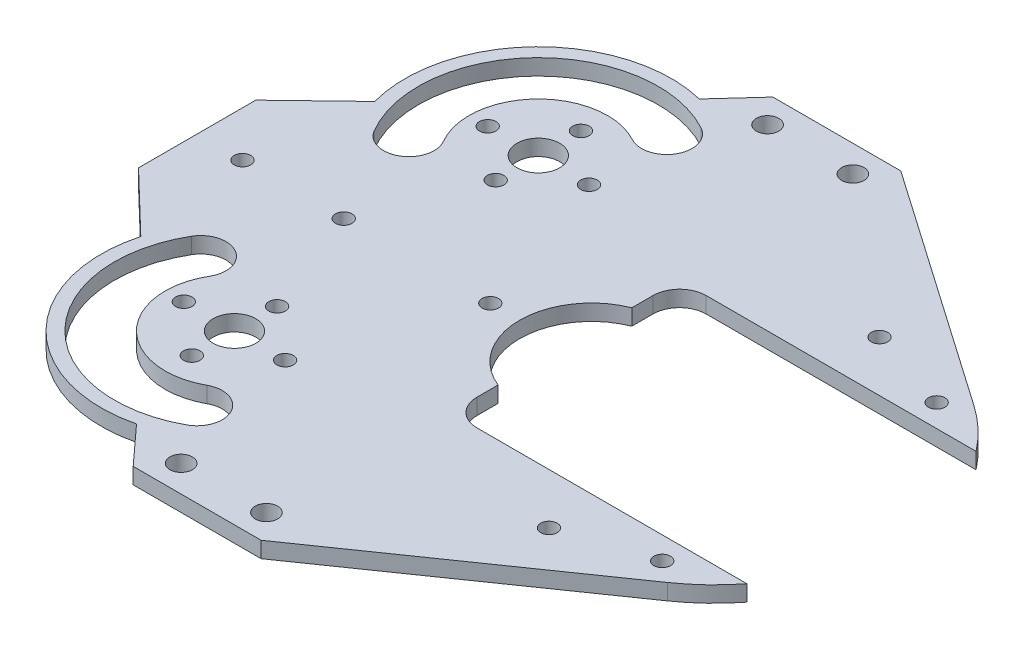
from build123d import *
from build123d.topology import SkipClean

# Parameters (mm, degrees)
SKETCH_1_R          = 1.55
SKETCH_1_R_2        = 4
EXTRUDE_1_DEPTH     = 3
EXTRUDE_START       = -3
SKETCH_2_R          = 2.1
EXTRUDE_3_DEPTH     = 3
FILLET_1_R          = 4
FILLET_2_R          = 314
FILLET_3_R          = 314
FILLET_4_R          = 4
CUT_EXTRUDE_2_DEPTH = 3
EXTRUDE_4_DEPTH     = 3
EXTRUDE_5_DEPTH     = 3
SKETCH_6_R          = 1.55
CUT_EXTRUDE_3_DEPTH = 10


with BuildPart() as part:
    # 草图1 → 凸台-拉伸1 (new body)
    with BuildSketch(Plane(origin=(0, 0, 0), x_dir=(1, 0, 0), z_dir=(0, 1, 0))):
        with BuildLine():
            Line((-27.819418646, 37.14796354), (-55, 11))
            Line((-55, 11), (-55, -11))
            Line((-55, -11), (-27.819418646, -37.14796354))
            ThreePointArc((-27.819418646, -37.14796354), (-23.984664844, -39.630488814), (-19.5, -40.5))
            Line((-19.5, -40.5), (-17.421399483, -40.31860482))
            Line((-17.421399483, -40.31860482), (45.042813224, -34.867481809))
            ThreePointArc((45.042813224, -34.867481809), (58.724014778, -30.74585061), (69.617928959, -21.5))
            Line((69.617928959, -21.5), (19, -21.5))
            ThreePointArc((19, -21.5), (15.464466094, -20.035533906), (14, -16.5))
            Line((14, -16.5), (14, -12.539936204))
            ThreePointArc((14, -12.539936204), (5.5, 0), (14, 12.539936204))
            Line((14, 12.539936204), (14, 16.5))
            ThreePointArc((14, 16.5), (15.464466094, 20.035533906), (19, 21.5))
            Line((19, 21.5), (69.617928959, 21.5))
            ThreePointArc((69.617928959, 21.5), (58.724014778, 30.74585061), (45.042813224, 34.867481809))
            Line((45.042813224, 34.867481809), (-17.421399483, 40.31860482))
            Line((-17.421399483, 40.31860482), (-19.5, 40.5))
            ThreePointArc((-19.5, 40.5), (-23.984664844, 39.630488814), (-27.819418646, 37.14796354))
        make_face()
        with Locations(Location((-29, -28.5, 0), (0, 0, 270))):
            Circle(SKETCH_1_R, mode=Mode.SUBTRACT)
        with Locations(Location((-19.5, -36.5, 0), (0, 0, 270))):
            Circle(SKETCH_1_R, mode=Mode.SUBTRACT)
        with Locations(Location((-19.5, -28.5, 0), (0, 0, 270))):
            Circle(SKETCH_1_R_2, mode=Mode.SUBTRACT)
        with Locations(Location((-10, -28.5, 0), (0, 0, 270))):
            Circle(SKETCH_1_R, mode=Mode.SUBTRACT)
        with Locations(Location((-19.5, -20.5, 0), (0, 0, 270))):
            Circle(SKETCH_1_R, mode=Mode.SUBTRACT)
        with Locations(Location((-46.5, 0, 0), (0, 0, 270))):
            Circle(SKETCH_1_R, mode=Mode.SUBTRACT)
        with Locations(Location((-27.5, 0, 0), (0, 0, 270))):
            Circle(SKETCH_1_R, mode=Mode.SUBTRACT)
        with Locations(Location((0, 0, 0), (0, 0, 270))):
            Circle(SKETCH_1_R, mode=Mode.SUBTRACT)
        with Locations(Location((-29, 28.5, 0), (0, 0, 270))):
            Circle(SKETCH_1_R, mode=Mode.SUBTRACT)
        with Locations(Location((-19.5, 20.5, 0), (0, 0, 270))):
            Circle(SKETCH_1_R, mode=Mode.SUBTRACT)
        with Locations(Location((-19.5, 28.5, 0), (0, 0, 270))):
            Circle(SKETCH_1_R_2, mode=Mode.SUBTRACT)
        with Locations(Location((-10, 28.5, 0), (0, 0, 270))):
            Circle(SKETCH_1_R, mode=Mode.SUBTRACT)
        with Locations(Location((-19.5, 36.5, 0), (0, 0, 270))):
            Circle(SKETCH_1_R, mode=Mode.SUBTRACT)
    extrude(amount=EXTRUDE_1_DEPTH)

    # 草图2 → 凸台-拉伸3 (add)
    with BuildSketch(Plane(origin=(0, 3, 0), x_dir=(1, 0, 0), z_dir=(0, 1, 0)).offset(EXTRUDE_START)):
        with BuildLine():
            Line((-7, 60), (-28.363974347, 36.588878709))
            ThreePointArc((-28.363974347, 36.588878709), (-26.665503977, 38.125775437), (-24.705947863, 39.311942788))
            Line((-24.705947863, 39.311942788), (-19.656872495, 39.177623495))
            Line((-19.656872495, 39.177623495), (-17.421399483, 40.31860482))
            Line((-17.421399483, 40.31860482), (17, 37.314720281))
            Line((17, 37.314720281), (17, 50))
            Line((17, 50), (17, 60))
            Line((17, 60), (-7, 60))
        make_face()
        with Locations(Location((13, 55, 0), (0, 0, 270))):
            Circle(SKETCH_2_R, mode=Mode.SUBTRACT)
        with Locations(Location((-3, 55, 0), (0, 0, 270))):
            Circle(SKETCH_2_R, mode=Mode.SUBTRACT)
    extrude_3 = extrude(amount=EXTRUDE_3_DEPTH)

    # 圆角1
    fillet_1_edges = [part.edges().sort_by_distance(p)[0] for p in [
        (17, 1.5, -37.314720281),
    ]]
    fillet(fillet_1_edges, radius=FILLET_1_R)

    # 圆角2
    # the kernel refuses this fillet: 314 mm, written as the material it adds along each edge
    with BuildSketch(Plane(origin=(-28.100791786, 0, -36.877280051), x_dir=(0.6740732257670936, 0, -0.7386645289330906), z_dir=(0, 1, 0))) as fillet_2_piece_1:
        with BuildLine():
            CenterArc((FILLET_2_R * 0.032536346624, FILLET_2_R), FILLET_2_R, 266.272924122, 3.727075878)
            Line((-FILLET_2_R * 0.0324675326171, FILLET_2_R * 0.0021149887469), (0, 0))
            Line((0, 0), (FILLET_2_R * 0.032536346624, 0))
        make_face()
    extrude(amount=3)

    # 镜向2: 凸台-拉伸3 across plane
    add(extrude_3.mirror(Plane.XY))

    # 圆角3
    # the kernel refuses this fillet: 314 mm, written as the material it adds along each edge
    with BuildSketch(Plane(origin=(-28.100791786, 0, 36.877280051), x_dir=(-0.7206636283184775, 0, -0.6932848871992288), z_dir=(0, 1, 0))) as fillet_3_piece_1:
        with BuildLine():
            CenterArc((FILLET_3_R * 0.0325363466241, FILLET_3_R), FILLET_3_R, 266.272924122, 3.727075878)
            Line((-FILLET_3_R * 0.0324675326171, FILLET_3_R * 0.0021149887469), (0, 0))
            Line((0, 0), (FILLET_3_R * 0.032536346624, 0))
        make_face()
    extrude(amount=3)

    # 圆角4
    fillet_4_edges = [part.edges().sort_by_distance(p)[0] for p in [
        (17, 1.5, 37.314720281),
    ]]
    fillet(fillet_4_edges, radius=FILLET_4_R)

    # 草图3 → 切除-拉伸2 (cut)
    with BuildSketch(Plane.XZ):
        with BuildLine():
            ThreePointArc((-8.686732059, 48.231275591), (-35.637539634, 44.178960889), (-38.911435654, 17.122558906))
            ThreePointArc((-38.911435654, 17.122558906), (-32.411561674, 15.426493388), (-30.715496156, 21.926367368))
            ThreePointArc((-30.715496156, 21.926367368), (-28.823911789, 37.55895518), (-13.252334078, 39.900292563))
            ThreePointArc((-13.252334078, 39.900292563), (-6.804041555, 41.782983067), (-8.686732059, 48.231275591))
        make_face()
    cut_extrude_2 = extrude(amount=-CUT_EXTRUDE_2_DEPTH, mode=Mode.SUBTRACT)

    # 草图4 → 凸台-拉伸4 (add)
    with SkipClean():  # the faces are left unmerged after this step: merging them gives an invalid solid
        with BuildSketch(Plane.XZ):
            with BuildLine():
                Line((-43.624805935, 21.943038922), (-41.535713139, 23.952764967))
                ThreePointArc((-41.535713139, 23.952764967), (-35.617955509, 44.199092655), (-15.534428758, 50.647781937))
                Line((-15.534428758, 50.647781937), (-13.580394358, 52.78905657))
                ThreePointArc((-13.580394358, 52.78905657), (-37.408839455, 45.943436284), (-43.624805935, 21.943038922))
            make_face()
            with BuildLine():
                ThreePointArc((-25.118289886, 40.223259732), (-28.812596517, 37.570586867), (-31.367097826, 33.807729194))
                ThreePointArc((-31.367097826, 33.807729194), (-28.219819959, 36.993214998), (-25.118289886, 40.223259732))
            make_face()
        extrude_4 = extrude(amount=-EXTRUDE_4_DEPTH)

    # 镜向9: 切除-拉伸2, 凸台-拉伸4 across plane
    with SkipClean():  # the faces are left unmerged after this step: merging them gives an invalid solid
        add(cut_extrude_2.mirror(Plane.XY), mode=Mode.SUBTRACT)
        add(extrude_4.mirror(Plane.XY))

    # 草图5 → 凸台-拉伸5 (add)
    with SkipClean():  # the faces are left unmerged after this step: merging them gives an invalid solid
        with BuildSketch(Plane(origin=(0, 3, 0), x_dir=(1, 0, 0), z_dir=(0, 1, 0)).offset(EXTRUDE_START)):
            with BuildLine():
                Line((17, 60), (61.975554983, 28.739819121))
                ThreePointArc((61.975554983, 28.739819121), (53.910011807, 32.911268872), (45.042813224, 34.867481809))
                Line((45.042813224, 34.867481809), (20.652249917, 36.995995963))
                ThreePointArc((20.652249917, 36.995995963), (18.051186651, 38.278167206), (17, 40.980851027))
                Line((17, 40.980851027), (17, 60))
            make_face()
            with BuildLine():
                Line((17, -40.980851027), (17, -60))
                Line((17, -60), (61.975554983, -28.739819121))
                ThreePointArc((61.975554983, -28.739819121), (53.910011807, -32.911268872), (45.042813224, -34.867481809))
                Line((45.042813224, -34.867481809), (20.652249917, -36.995995963))
                ThreePointArc((20.652249917, -36.995995963), (18.051186651, -38.278167206), (17, -40.980851027))
            make_face()
        extrude(amount=EXTRUDE_5_DEPTH)

    # 草图6 → 切除-拉伸3 (cut)
    with SkipClean():  # the faces are left unmerged after this step: merging them gives an invalid solid
        with BuildSketch(Plane.XZ):
            with Locations(Location((42, 31, 0), (0, 0, 270))):
                Circle(SKETCH_6_R)
            with Locations(Location((57.97553464, 25.73983326, 0), (0, 0, 270))):
                Circle(SKETCH_6_R)
        cut_extrude_3 = extrude(amount=-CUT_EXTRUDE_3_DEPTH, mode=Mode.SUBTRACT)

    # 镜向10: 切除-拉伸3 across plane
    with SkipClean():  # the faces are left unmerged after this step: merging them gives an invalid solid
        add(cut_extrude_3.mirror(Plane.XY), mode=Mode.SUBTRACT)


solid = part.part
